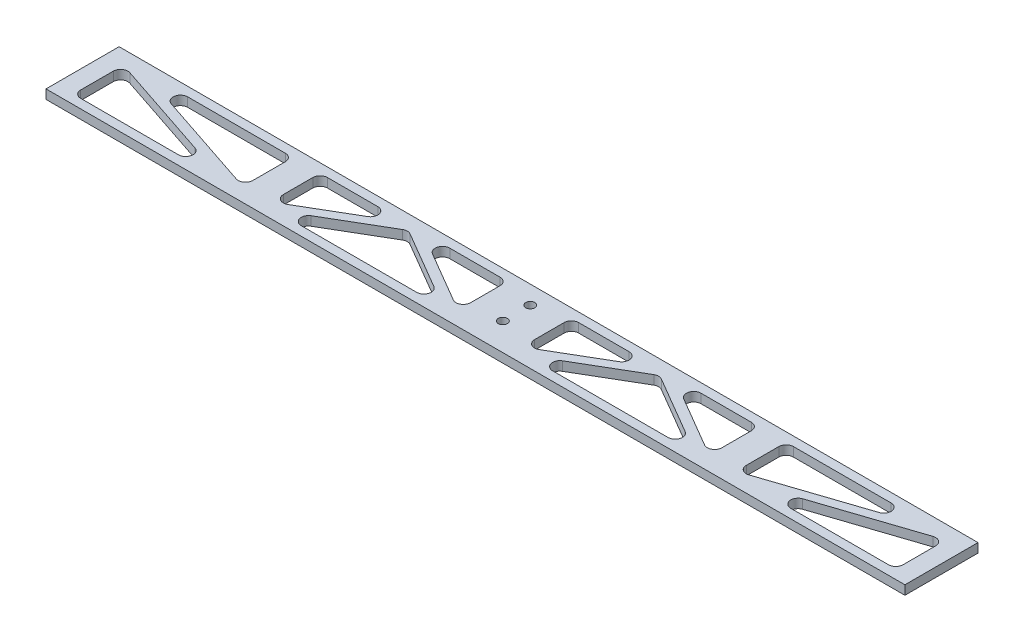
from build123d import *

# Parameters (mm, degrees)
SKETCH1_W           = 298.45
SKETCH1_H           = 25.4
BOSS_EXTRUDE1_DEPTH = 3.175
CUT_EXTRUDE1_DEPTH  = 150.798101623
SKETCH3_R           = 1.5875
CUT_EXTRUDE2_DEPTH  = 150.798101623
FILLET1_R           = 2.54


with BuildPart() as part:
    # Sketch1 → Boss-Extrude1 (new body)
    with BuildSketch(Plane(origin=(0, 0, 0), x_dir=(1, 0, 0), z_dir=(0, 1, 0))):
        Rectangle(SKETCH1_W, SKETCH1_H)
    extrude(amount=BOSS_EXTRUDE1_DEPTH)

    # Sketch2 → Cut-Extrude1 (cut, through all)
    with BuildSketch(Plane(origin=(0, 3.175, 0), x_dir=(1, 0, 0), z_dir=(0, 1, 0))):
        Polygon((90.745115786, -9.525), (142.875, -9.525), (142.875, 7.851628071), align=None)
        Polygon((85.725, -7.851628071), (137.854884214, 9.525), (85.725, 9.525), align=None)
        Polygon((76.2, -7.685517516), (76.2, 9.525), (46.798699244, 9.525), align=None)
        Polygon((14.254949244, -9.525), (73.057550756, -9.525), (43.65625, 7.685517516), align=None)
        Polygon((11.1125, -7.685517516), (40.513800756, 9.525), (11.1125, 9.525), align=None)
        Polygon((-11.1125, -7.685517516), (-11.1125, 9.525), (-40.513800756, 9.525), align=None)
        Polygon((-73.057550756, -9.525), (-14.254949244, -9.525), (-43.65625, 7.685517516), align=None)
        Polygon((-76.2, -7.685517516), (-46.798699244, 9.525), (-76.2, 9.525), align=None)
        Polygon((-85.725, -7.851628071), (-85.725, 9.525), (-137.854884214, 9.525), align=None)
        Polygon((-142.875, -9.525), (-90.745115786, -9.525), (-142.875, 7.851628071), align=None)
    extrude(amount=-CUT_EXTRUDE1_DEPTH, mode=Mode.SUBTRACT)

    # Sketch3 → Cut-Extrude2 (cut, through all)
    with BuildSketch(Plane(origin=(0, 3.175, 0), x_dir=(1, 0, 0), z_dir=(0, 1, 0))):
        with Locations((0, 6.35)):
            Circle(SKETCH3_R)
        with Locations((0, -3.175)):
            Circle(SKETCH3_R)
    extrude(amount=-CUT_EXTRUDE2_DEPTH, mode=Mode.SUBTRACT)

    # Fillet1
    fillet1_edges = [part.edges().sort_by_distance(p)[0] for p in [
        (-14.254949244, 1.5875, 9.525),
        (-73.057550756, 1.5875, 9.525),
        (-43.65625, 1.5875, -7.685517516),
        (-11.1125, 1.5875, 7.685517516),
        (-40.513800756, 1.5875, -9.525),
        (-11.1125, 1.5875, -9.525),
        (-46.798699244, 1.5875, -9.525),
        (-76.2, 1.5875, 7.685517516),
        (-76.2, 1.5875, -9.525),
        (73.057550756, 1.5875, 9.525),
        (14.254949244, 1.5875, 9.525),
        (43.65625, 1.5875, -7.685517516),
        (142.875, 1.5875, -7.851628071),
        (142.875, 1.5875, 9.525),
        (90.745115786, 1.5875, 9.525),
        (40.513800756, 1.5875, -9.525),
        (11.1125, 1.5875, 7.685517516),
        (11.1125, 1.5875, -9.525),
        (76.2, 1.5875, 7.685517516),
        (46.798699244, 1.5875, -9.525),
        (76.2, 1.5875, -9.525),
        (137.854884214, 1.5875, -9.525),
        (85.725, 1.5875, 7.851628071),
        (85.725, 1.5875, -9.525),
        (-137.854884214, 1.5875, -9.525),
        (-85.725, 1.5875, 7.851628071),
        (-85.725, 1.5875, -9.525),
        (-90.745115786, 1.5875, 9.525),
        (-142.875, 1.5875, 9.525),
        (-142.875, 1.5875, -7.851628071),
    ]]
    fillet(fillet1_edges, radius=FILLET1_R)


solid = part.part
